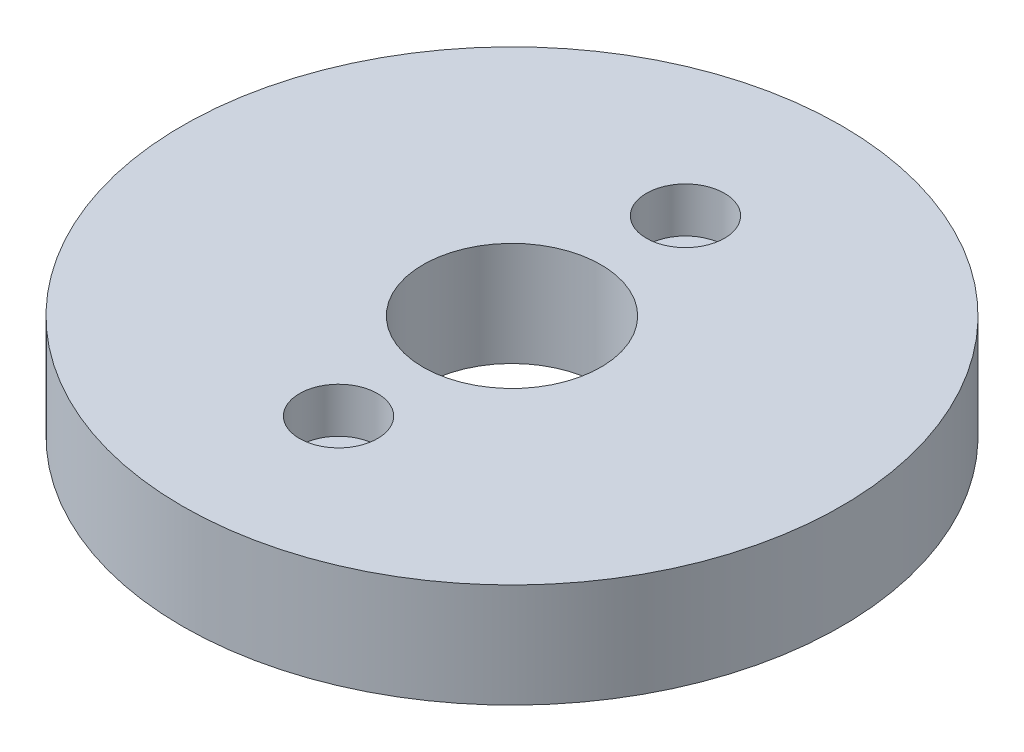
from build123d import *

# Parameters (mm, degrees)
SKETCH1_R           = 38
BOSS_EXTRUDE1_DEPTH = 12
SKETCH2_R           = 2.75
CUT_EXTRUDE1_DEPTH  = 25
SKETCH4_R           = 10.25
CUT_EXTRUDE2_DEPTH  = 25
SKETCH3_R           = 4.5
CUT_EXTRUDE3_DEPTH  = 5.2


with BuildPart() as part:
    # Sketch1 → Boss-Extrude1 (new body)
    with BuildSketch(Plane(origin=(0, 0, 0), x_dir=(1, 0, 0), z_dir=(0, 1, 0))):
        Circle(SKETCH1_R)
    extrude(amount=BOSS_EXTRUDE1_DEPTH)

    # Sketch2 → Cut-Extrude1 (cut)
    with BuildSketch(Plane(origin=(0, 12, 0), x_dir=(1, 0, 0), z_dir=(0, 1, 0))):
        with Locations((0, 20)):
            Circle(SKETCH2_R)
        with Locations((0, -20)):
            Circle(SKETCH2_R)
    extrude(amount=-CUT_EXTRUDE1_DEPTH, mode=Mode.SUBTRACT)

    # Sketch4 → Cut-Extrude2 (cut)
    with BuildSketch(Plane(origin=(0, 12, 0), x_dir=(1, 0, 0), z_dir=(0, 1, 0))):
        Circle(SKETCH4_R)
    extrude(amount=-CUT_EXTRUDE2_DEPTH, mode=Mode.SUBTRACT)

    # Sketch3 → Cut-Extrude3 (cut)
    with BuildSketch(Plane(origin=(0, 12, 0), x_dir=(1, 0, 0), z_dir=(0, 1, 0))):
        with Locations((0, 20)):
            Circle(SKETCH3_R)
        with Locations((0, -20)):
            Circle(SKETCH3_R)
    extrude(amount=-CUT_EXTRUDE3_DEPTH, mode=Mode.SUBTRACT)


solid = part.part
